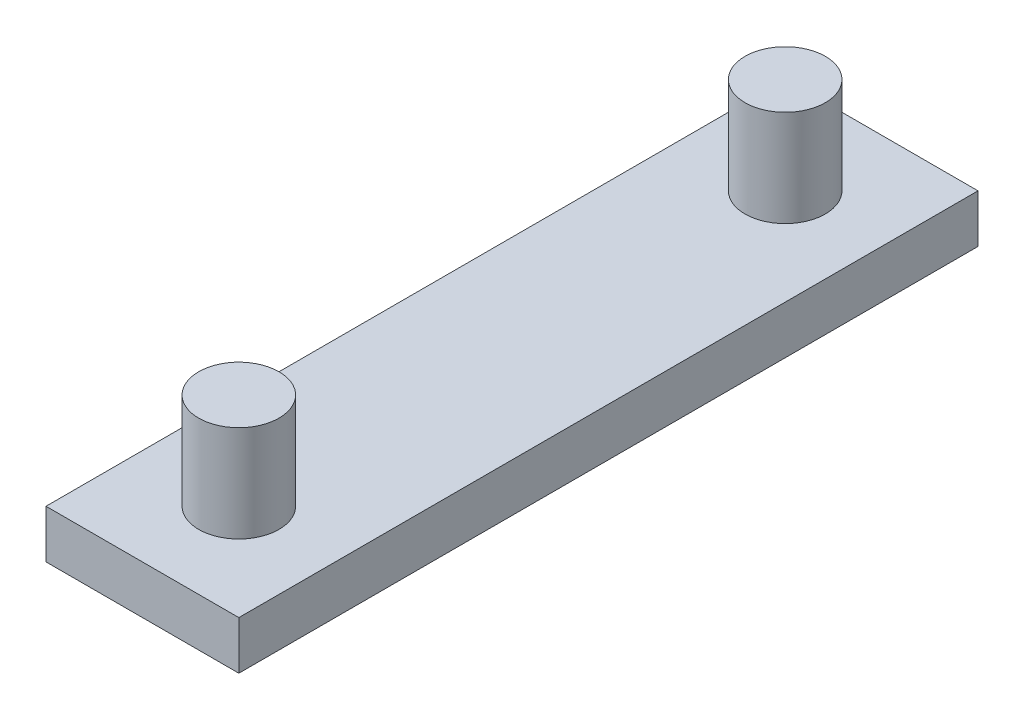
from build123d import *

# Parameters (mm, degrees)
SKETCH3_R             = 2.5
BOSS_EXTRUDE4_DEPTH   = 9
BOSS_EXTRUDE4_2_DEPTH = 9
SKETCH2_W             = 12
SKETCH2_H             = 46
BOSS_EXTRUDE5_DEPTH   = 3


with BuildPart() as part:
    # Sketch3 → Boss-Extrude4 (new body)
    with BuildSketch(Plane(origin=(0, 0, 0), x_dir=(1, 0, 0), z_dir=(0, 1, 0))):
        with Locations((-0.169934853, 17.143306367)):
            Circle(SKETCH3_R)
    extrude(amount=BOSS_EXTRUDE4_DEPTH)



with BuildPart() as body_2:
    # Sketch3 → Boss-Extrude4 2 (new body)
    with BuildSketch(Plane(origin=(0, 0, 0), x_dir=(1, 0, 0), z_dir=(0, 1, 0))):
        with Locations((-0.169934853, -16.856693633)):
            Circle(SKETCH3_R)
    extrude(amount=BOSS_EXTRUDE4_2_DEPTH)


with BuildPart() as part_1:
    add(part.part)

    add(body_2.part)  # Boss-Extrude5 merges body 2
    # Sketch2 → Boss-Extrude5 (add)
    with BuildSketch(Plane(origin=(0, 0, 0), x_dir=(1, 0, 0), z_dir=(0, 1, 0))):
        with Locations((-0.169934853, 0.143306367)):
            Rectangle(SKETCH2_W, SKETCH2_H)
    extrude(amount=BOSS_EXTRUDE5_DEPTH)


solid = part_1.part
